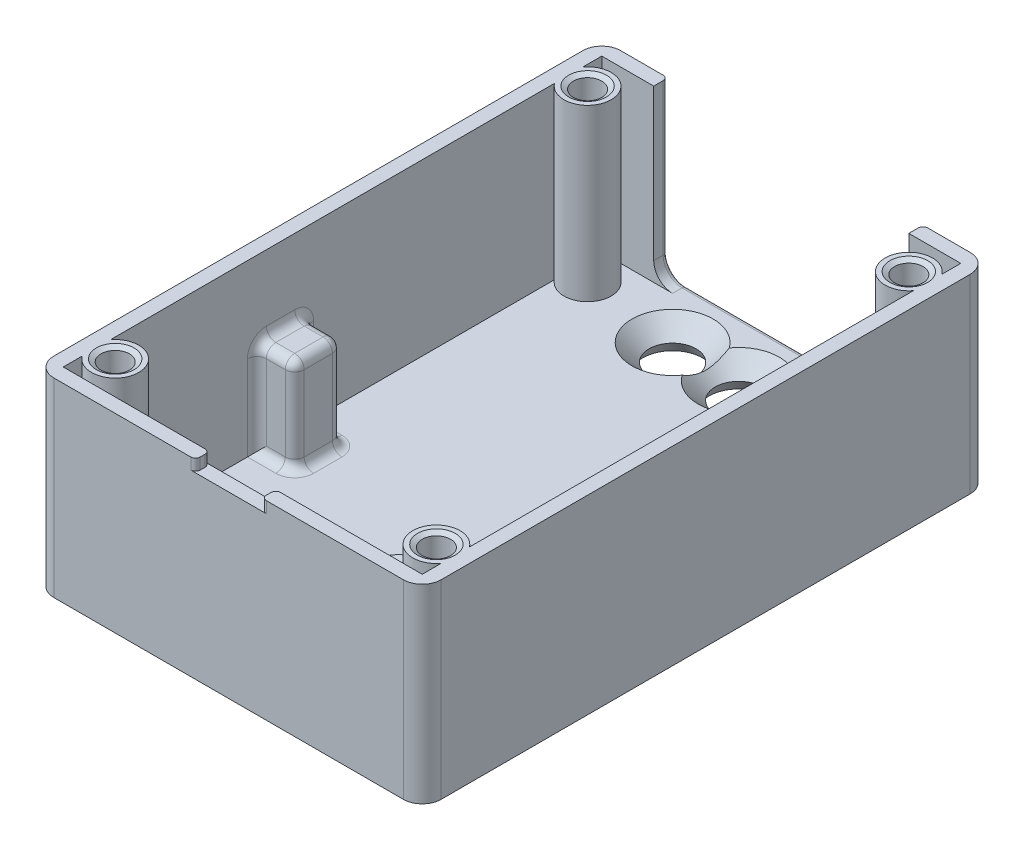
from build123d import *
from OCP.BRepFilletAPI import BRepFilletAPI_MakeChamfer

# Parameters (mm, degrees)
SKETCH_1_W          = 41
SKETCH_1_H          = 60
SKETCH_1_R          = 2.3
SKETCH_1_R_2        = 1.9
EXTRUDE_1_DEPTH     = 3
CHAMFER_1_SIZE      = 2
SKETCH_2_W          = 41
SKETCH_2_H          = 60
SKETCH_2_W_2        = 38
SKETCH_2_H_2        = 57
EXTRUDE_1_2_DEPTH   = 18
SKETCH_3_W          = 27
SKETCH_3_H          = 3.030341357
CUT_EXTRUDE_1_DEPTH = 18
SKETCH_4_R          = 2.5
EXTRUDE_2_DEPTH     = 18
SKETCH_5_R          = 1.5
CUT_EXTRUDE_2_DEPTH = 10
SKETCH_7_W          = 7
SKETCH_7_H          = 4.356080651
CUT_EXTRUDE_3_DEPTH = 1.2
FILLET_2_R          = 0.5
FILLET_3_R          = 2
CHAMFER_4_SIZE      = 0.866025404
CHAMFER_4_SIZE_2    = 1.5
CHAMFER_6_SIZE      = 0.5
CHAMFER_6_SIZE2     = 0.288675135
SKETCH_8_W          = 4
SKETCH_8_H          = 5
EXTRUDE_3_DEPTH     = 10
FILLET_6_R          = 1
FILLET_7_R          = 2
FILLET_8_R          = 0.5
CHAMFER_7_SIZE      = 1


with BuildPart() as part:
    # Эскиз1 → Extrude 1 (new body)
    with BuildSketch(Plane(origin=(0, 0, 0), x_dir=(1, 0, 0), z_dir=(0, 1, 0))):
        Rectangle(SKETCH_1_W, SKETCH_1_H)
        with Locations(Location((0, 24, 0), (0, 0, 270))):
            Circle(SKETCH_1_R, mode=Mode.SUBTRACT)
        with Locations(Location((0, -24, 0), (0, 0, 270))):
            Circle(SKETCH_1_R, mode=Mode.SUBTRACT)
        with Locations(Location((0, -12, 0), (0, 0, 270))):
            Circle(SKETCH_1_R_2, mode=Mode.SUBTRACT)
        with Locations(Location((-7, -24, 0), (0, 0, 90))):
            Circle(SKETCH_1_R, mode=Mode.SUBTRACT)
        with Locations(Location((-7, 24, 0), (0, 0, 90))):
            Circle(SKETCH_1_R, mode=Mode.SUBTRACT)
    extrude(amount=EXTRUDE_1_DEPTH)

    # Фаска1
    # the kernel refuses this chamfer: 2 mm, written as the material it takes off along each edge
    with BuildSketch(Plane(origin=(0, 3, -24), x_dir=(0, 0, 1), z_dir=(-1, 0, 0))) as chamfer_1_piece_1:
        Polygon((2.3, -CHAMFER_1_SIZE), (2.3 + CHAMFER_1_SIZE, 0), (2.3, 0), align=None)
    revolve(axis=Axis((0, 3, -24), (0, 1, 0)), mode=Mode.SUBTRACT)
    with BuildSketch(Plane(origin=(0, 3, 24), x_dir=(0, 0, 1), z_dir=(-1, 0, 0))) as chamfer_1_piece_2:
        Polygon((2.3, -CHAMFER_1_SIZE), (2.3 + CHAMFER_1_SIZE, 0), (2.3, 0), align=None)
    revolve(axis=Axis((0, 3, 24), (0, 1, 0)), mode=Mode.SUBTRACT)
    with BuildSketch(Plane(origin=(-7, 3, 24), x_dir=(0, 0, -1), z_dir=(1, 0, 0))) as chamfer_1_piece_3:
        Polygon((2.3, -CHAMFER_1_SIZE), (2.3 + CHAMFER_1_SIZE, 0), (2.3, 0), align=None)
    revolve(axis=Axis((-7, 3, 24), (0, 1, 0)), mode=Mode.SUBTRACT)
    with BuildSketch(Plane(origin=(-7, 3, -24), x_dir=(0, 0, -1), z_dir=(1, 0, 0))) as chamfer_1_piece_4:
        Polygon((2.3, -CHAMFER_1_SIZE), (2.3 + CHAMFER_1_SIZE, 0), (2.3, 0), align=None)
    revolve(axis=Axis((-7, 3, -24), (0, 1, 0)), mode=Mode.SUBTRACT)

    # Эскиз2 → Extrude 1 2 (add)
    with BuildSketch(Plane(origin=(0, 3, 0), x_dir=(1, 0, 0), z_dir=(0, 1, 0))):
        Rectangle(SKETCH_2_W, SKETCH_2_H)
        Rectangle(SKETCH_2_W_2, SKETCH_2_H_2, mode=Mode.SUBTRACT)
    extrude(amount=EXTRUDE_1_2_DEPTH)

    # Эскиз3 → Вырез-Вытянуть1 (cut)
    with BuildSketch(Plane(origin=(0, 21, 0), x_dir=(1, 0, 0), z_dir=(0, 1, 0))):
        with Locations((0, 29.478101209)):
            Rectangle(SKETCH_3_W, SKETCH_3_H)
    extrude(amount=-CUT_EXTRUDE_1_DEPTH, mode=Mode.SUBTRACT)

    # Эскиз4 → Бобышка-Вытянуть2 (add)
    with BuildSketch(Plane(origin=(0, 3, 0), x_dir=(1, 0, 0), z_dir=(0, 1, 0))):
        with Locations((17, 25)):
            Circle(SKETCH_4_R)
        with Locations((-17, 25)):
            Circle(SKETCH_4_R)
        with Locations((17, -25)):
            Circle(SKETCH_4_R)
        with Locations((-17, -25)):
            Circle(SKETCH_4_R)
    extrude(amount=EXTRUDE_2_DEPTH)

    # Эскиз5 → Вырез-Вытянуть2 (cut)
    with BuildSketch(Plane(origin=(0, 21, 0), x_dir=(1, 0, 0), z_dir=(0, 1, 0))):
        with Locations(Location((17, 25, 0), (0, 0, 270))):
            Circle(SKETCH_5_R)
        with Locations(Location((17, -25, 0), (0, 0, 270))):
            Circle(SKETCH_5_R)
        with Locations(Location((-17, -25, 0), (0, 0, 270))):
            Circle(SKETCH_5_R)
        with Locations(Location((-17, 25, 0), (0, 0, 270))):
            Circle(SKETCH_5_R)
    extrude(amount=-CUT_EXTRUDE_2_DEPTH, mode=Mode.SUBTRACT)

    # Эскиз7 → Вырез-Вытянуть3 (cut)
    with BuildSketch(Plane(origin=(0, 21, 0), x_dir=(1, 0, 0), z_dir=(0, 1, 0))):
        with Locations((0, -28.804800006)):
            Rectangle(SKETCH_7_W, SKETCH_7_H)
    extrude(amount=-CUT_EXTRUDE_3_DEPTH, mode=Mode.SUBTRACT)

    # Скругление2
    fillet_2_edges = [part.edges().sort_by_distance(p)[0] for p in [
        (-3.5, 20.4, 28.5),
        (3.5, 20.4, 28.5),
        (3.5, 20.4, 30),
        (-3.5, 20.4, 30),
    ]]
    fillet(fillet_2_edges, radius=FILLET_2_R)

    # Скругление3
    fillet_3_edges = [part.edges().sort_by_distance(p)[0] for p in [
        (20.5, 10.5, 30),
        (-20.5, 10.5, 30),
        (-20.5, 10.5, -30),
        (20.5, 10.5, -30),
    ]]
    fillet(fillet_3_edges, radius=FILLET_3_R)

    # Фаска4
    # the kernel refuses this chamfer: 1.5, 0.866025404 mm, written as the material it takes off along each edge
    with BuildSketch(Plane(origin=(0, 0, 24), x_dir=(0, 0, 1), z_dir=(-1, 0, 0))) as chamfer_4_piece_1:
        Polygon((2.3 + CHAMFER_4_SIZE, 0), (2.3, CHAMFER_4_SIZE_2), (2.3, 0), align=None)
    revolve(axis=Axis((0, 0, 24), (0, 1, 0)), mode=Mode.SUBTRACT)
    with BuildSketch(Plane(origin=(18.5, 0, -30), x_dir=(0, -0.01932676561270073, 0.999813220622208), z_dir=(-1, 0, 0))) as chamfer_4_piece_2:
        Polygon((CHAMFER_4_SIZE_2 * 0.999813220622, CHAMFER_4_SIZE_2 * 0.0193267656127), (-CHAMFER_4_SIZE * 0.0193267656079, CHAMFER_4_SIZE * 0.999813220373), (0, 0), align=None)
    extrude(amount=37, mode=Mode.SUBTRACT)
    with BuildSketch(Plane(origin=(-20.5, 0, -28), x_dir=(0.999813220622208, -0.01932676561270073, 0), z_dir=(0, 0, 1)), Plane(origin=(20.5, 0, 28), x_dir=(-0.999813220622208, -0.01932676561270073, 0), z_dir=(0, 0, -1))) as chamfer_4_piece_3:
        Polygon((CHAMFER_4_SIZE_2 * 0.999813220622, CHAMFER_4_SIZE_2 * 0.0193267656127), (-CHAMFER_4_SIZE * 0.0193267656079, CHAMFER_4_SIZE * 0.999813220373), (0, 0), align=None)
    extrude(amount=56, mode=Mode.SUBTRACT)
    with BuildSketch(Plane(origin=(-18.5, 0, 30), x_dir=(0, 0.9983227437537924, 0.0578938624026721), z_dir=(1, 0, 0))) as chamfer_4_piece_4:
        Polygon((CHAMFER_4_SIZE * 0.998322743505, -CHAMFER_4_SIZE * 0.0578938623883), (-CHAMFER_4_SIZE_2 * 0.0578938624027, -CHAMFER_4_SIZE_2 * 0.998322743754), (0, 0), align=None)
    extrude(amount=37, mode=Mode.SUBTRACT)
    with BuildSketch(Plane(origin=(-18.5, 0, -28), x_dir=(0, 0, -1), z_dir=(1, 0, 0))) as chamfer_4_piece_5:
        Polygon((2 - CHAMFER_4_SIZE_2, 0), (2, CHAMFER_4_SIZE), (2, 0), align=None)
    revolve(axis=Axis((-18.5, 0, -28), (0, 1, 0)), revolution_arc=90, mode=Mode.SUBTRACT)
    with BuildSketch(Plane(origin=(-18.5, 0, 28), x_dir=(0, 0, 1), z_dir=(1, 0, 0))) as chamfer_4_piece_6:
        Polygon((2 - CHAMFER_4_SIZE_2, 0), (2, -CHAMFER_4_SIZE), (2, 0), align=None)
    revolve(axis=Axis((-18.5, 0, 28), (0, -1, 0)), revolution_arc=90, mode=Mode.SUBTRACT)
    with BuildSketch(Plane(origin=(18.5, 0, 28), x_dir=(0, 0, 1), z_dir=(-1, 0, 0))) as chamfer_4_piece_7:
        Polygon((2, CHAMFER_4_SIZE), (2 - CHAMFER_4_SIZE_2, 0), (2, 0), align=None)
    revolve(axis=Axis((18.5, 0, 28), (0, 1, 0)), revolution_arc=90, mode=Mode.SUBTRACT)
    with BuildSketch(Plane(origin=(18.5, 0, -28), x_dir=(0, 0, -1), z_dir=(-1, 0, 0))) as chamfer_4_piece_8:
        Polygon((2 - CHAMFER_4_SIZE_2, 0), (2, -CHAMFER_4_SIZE), (2, 0), align=None)
    revolve(axis=Axis((18.5, 0, -28), (0, -1, 0)), revolution_arc=90, mode=Mode.SUBTRACT)
    with BuildSketch(Plane(origin=(0, 0, -24), x_dir=(0, 0, 1), z_dir=(-1, 0, 0))) as chamfer_4_piece_9:
        Polygon((2.3 + CHAMFER_4_SIZE, 0), (2.3, CHAMFER_4_SIZE_2), (2.3, 0), align=None)
    revolve(axis=Axis((0, 0, -24), (0, 1, 0)), mode=Mode.SUBTRACT)
    with BuildSketch(Plane(origin=(0, 0, 12), x_dir=(0, 0, 1), z_dir=(-1, 0, 0))) as chamfer_4_piece_10:
        Polygon((1.9 + CHAMFER_4_SIZE, 0), (1.9, CHAMFER_4_SIZE_2), (1.9, 0), align=None)
    revolve(axis=Axis((0, 0, 12), (0, 1, 0)), mode=Mode.SUBTRACT)
    with BuildSketch(Plane(origin=(-7, 0, -24), x_dir=(0, 0, -1), z_dir=(1, 0, 0))) as chamfer_4_piece_11:
        Polygon((2.3 + CHAMFER_4_SIZE, 0), (2.3, CHAMFER_4_SIZE_2), (2.3, 0), align=None)
    revolve(axis=Axis((-7, 0, -24), (0, 1, 0)), mode=Mode.SUBTRACT)
    with BuildSketch(Plane(origin=(-7, 0, 24), x_dir=(0, 0, -1), z_dir=(1, 0, 0))) as chamfer_4_piece_12:
        Polygon((2.3 + CHAMFER_4_SIZE, 0), (2.3, CHAMFER_4_SIZE_2), (2.3, 0), align=None)
    revolve(axis=Axis((-7, 0, 24), (0, 1, 0)), mode=Mode.SUBTRACT)

    # Фаска6: one chamfer whose edges measure the first distance from different faces: ONE call of the kernel's chamfer builder (chamfer() names one face for all edges)
    chamfer_6_edges_1 = [part.edges().sort_by_distance(p)[0] for p in [
        (-17, 21, -26.5),
        (-17, 21, 23.5),
    ]]
    chamfer_6_side_1 = [part.faces().sort_by_distance(p)[0] for p in [
        (-11.25, 21, 29.376381527),
    ]]
    chamfer_6_edges_2 = [part.edges().sort_by_distance(p)[0] for p in [
        (17, 21, 23.5),
        (17, 21, -26.5),
    ]]
    chamfer_6_side_2 = [part.faces().sort_by_distance(p)[0] for p in [
        (11.25, 21, 29.376381527),
    ]]
    chamfer_6 = BRepFilletAPI_MakeChamfer(part.part.solid().wrapped)
    for e in chamfer_6_edges_1:
        chamfer_6.Add(CHAMFER_6_SIZE, CHAMFER_6_SIZE2, e.wrapped, chamfer_6_side_1[0].wrapped)  # the first distance lies on this face
    for e in chamfer_6_edges_2:
        chamfer_6.Add(CHAMFER_6_SIZE, CHAMFER_6_SIZE2, e.wrapped, chamfer_6_side_2[0].wrapped)  # the first distance lies on this face
    add(Compound.cast(chamfer_6.Shape()), mode=Mode.REPLACE)

    # Эскиз8 → Бобышка-Вытянуть3 (add)
    with BuildSketch(Plane(origin=(0, 3, 0), x_dir=(1, 0, 0), z_dir=(0, 1, 0))):
        with Locations((17, -14)):
            Rectangle(SKETCH_8_W, SKETCH_8_H)
        with Locations((-17, -5.5)):
            Rectangle(SKETCH_8_W, SKETCH_8_H)
    extrude(amount=EXTRUDE_3_DEPTH)

    # Скругление6
    fillet_6_edges = [part.edges().sort_by_distance(p)[0] for p in [
        (19, 8, 16.5),
        (17, 3, 11.5),
        (19, 8, 11.5),
        (15, 3, 14),
        (15, 8, 11.5),
        (17, 3, 16.5),
        (15, 8, 16.5),
        (19, 13, 14),
        (17, 13, 11.5),
        (15, 13, 14),
        (17, 13, 16.5),
        (-19, 8, 3),
        (-17, 3, 8),
        (-19, 8, 8),
        (-15, 3, 5.5),
        (-15, 8, 8),
        (-17, 3, 3),
        (-15, 8, 3),
        (-19, 13, 5.5),
        (-17, 13, 8),
        (-15, 13, 5.5),
        (-17, 13, 3),
    ]]
    fillet(fillet_6_edges, radius=FILLET_6_R)

    # Скругление7
    fillet_7_edges = [part.edges().sort_by_distance(p)[0] for p in [
        (-13.5, 3, -29.25),
        (13.5, 3, -29.25),
    ]]
    fillet(fillet_7_edges, radius=FILLET_7_R)

    # Скругление8
    fillet_8_edges = [part.edges().sort_by_distance(p)[0] for p in [
        (0, 3, -30),
        (13.5, 13, -30),
        (12.914213562, 3.585786438, -30),
        (-12.914213562, 3.585786438, -30),
        (-13.5, 13, -30),
    ]]
    fillet(fillet_8_edges, radius=FILLET_8_R)

    # Фаска7
    chamfer_7_edges = [part.edges().sort_by_distance(p)[0] for p in [
        (0, 3, 10.1),
    ]]
    chamfer(chamfer_7_edges, length=CHAMFER_7_SIZE)


solid = part.part
